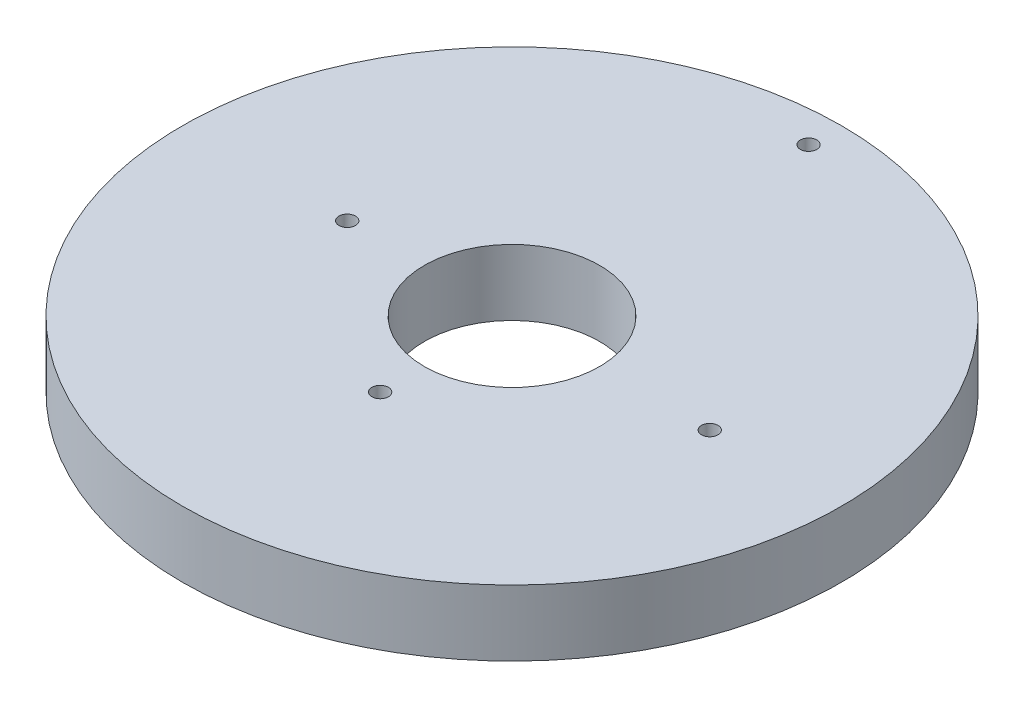
from build123d import *

# Parameters (mm, degrees)
SKETCH1_R           = 63.5
SKETCH1_R_2         = 16.891
SKETCH1_R_3         = 1.5875
BOSS_EXTRUDE1_DEPTH = 12.7


with BuildPart() as part:
    # Sketch1 → Boss-Extrude1 (new body)
    with BuildSketch(Plane(origin=(0, 0, 0), x_dir=(1, 0, 0), z_dir=(0, 1, 0))):
        Circle(SKETCH1_R)
        Circle(SKETCH1_R_2, mode=Mode.SUBTRACT)
        with Locations((0, 57.15)):
            Circle(SKETCH1_R_3, mode=Mode.SUBTRACT)
        with Locations((38.1, 0)):
            Circle(SKETCH1_R_3, mode=Mode.SUBTRACT)
        with Locations((-31.75, 0)):
            Circle(SKETCH1_R_3, mode=Mode.SUBTRACT)
        with Locations((0, -25.4)):
            Circle(SKETCH1_R_3, mode=Mode.SUBTRACT)
    extrude(amount=BOSS_EXTRUDE1_DEPTH)


solid = part.part
